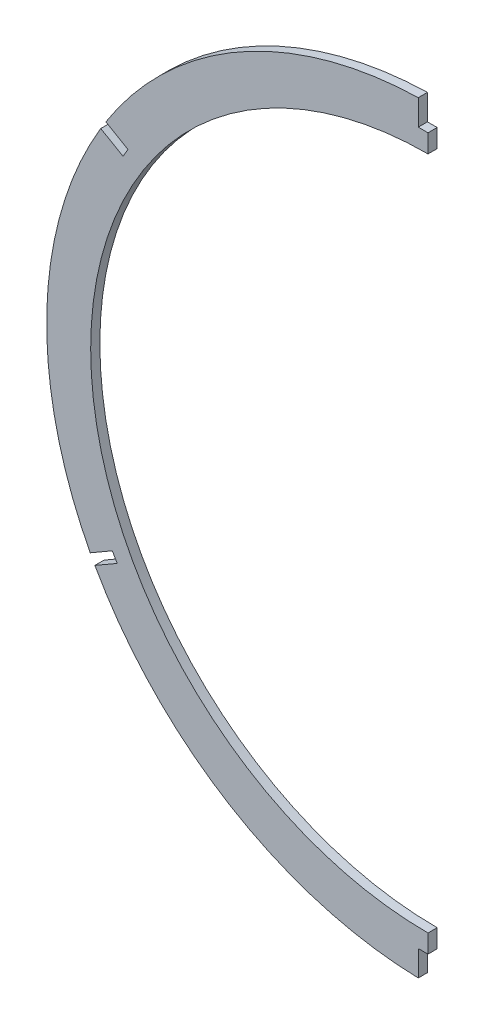
from build123d import *

# Parameters (mm, degrees)
SKETCH2_R           = 116.84
BOSS_EXTRUDE1_DEPTH = 1.5875
SKETCH3_W           = 232.210592103
SKETCH3_H           = 398.954583541
CUT_EXTRUDE1_DEPTH  = 190.3271535
SKETCH4_W           = 3.3782
SKETCH4_H           = 10.16
CUT_EXTRUDE2_DEPTH  = 190.347119125


with BuildPart() as part:
    # Sketch2 → Boss-Extrude1 (new, symmetric)
    with BuildSketch(Plane.XY):
        with BuildLine():
            ThreePointArc((-1.651, 128.513680847), (-113.443755652, 64.087482344), (-116.974071472, -64.89271823))
            ThreePointArc((-116.974071472, -64.89271823), (-116.588202689, -65.623039511), (-116.197774242, -66.350933404))
            ThreePointArc((-116.197774242, -66.350933404), (-115.802941233, -67.076116512), (-115.403582459, -67.798817153))
            ThreePointArc((-115.403582459, -67.798817153), (0, -135.636), (115.403582459, -67.798817153))
            ThreePointArc((115.403582459, -67.798817153), (115.802941375, -67.076116254), (116.197774523, -66.350932884))
            ThreePointArc((116.197774523, -66.350932884), (116.588202828, -65.62303925), (116.974071472, -64.89271823))
            ThreePointArc((116.974071472, -64.89271823), (113.443755652, 64.087482344), (1.651, 128.513680847))
            ThreePointArc((1.651, 128.513680847), (0.825516124, 128.521420187), (0, 128.524))
            ThreePointArc((0, 128.524), (-0.825516124, 128.521420187), (-1.651, 128.513680847))
        make_face()
        with Locations((0, -3.556)):
            Circle(SKETCH2_R, mode=Mode.SUBTRACT)
    extrude(amount=BOSS_EXTRUDE1_DEPTH, both=True)

    # Sketch3 → Cut-Extrude1 (cut, through all)
    with BuildSketch(Plane(origin=(0, 0, 0), x_dir=(0, 0, -1), z_dir=(1, 0, 0))):
        with Locations((6.714523145, -6.913261573)):
            Rectangle(SKETCH3_W, SKETCH3_H)
    extrude(amount=CUT_EXTRUDE1_DEPTH, mode=Mode.SUBTRACT)

    # Sketch4 → Cut-Extrude2 (cut, through all)
    with BuildSketch(Plane.XY.offset(1.5875)):
        with Locations((-1.6891, 124.714)):
            Rectangle(SKETCH4_W, SKETCH4_H)
        Polygon((-105.620566898, 59.765541567), (-103.931466898, 62.691148586), (-112.730285, 67.771148586), (-114.419385, 64.845541567), align=None)
        with Locations((-1.6891, -131.826)):
            Rectangle(SKETCH4_W, SKETCH4_H)
        Polygon((-107.648347053, -63.365323312), (-109.337447053, -60.439716293), (-118.136265155, -65.519716293), (-116.447165155, -68.445323312), align=None)
    extrude(amount=-CUT_EXTRUDE2_DEPTH, mode=Mode.SUBTRACT)


solid = part.part
